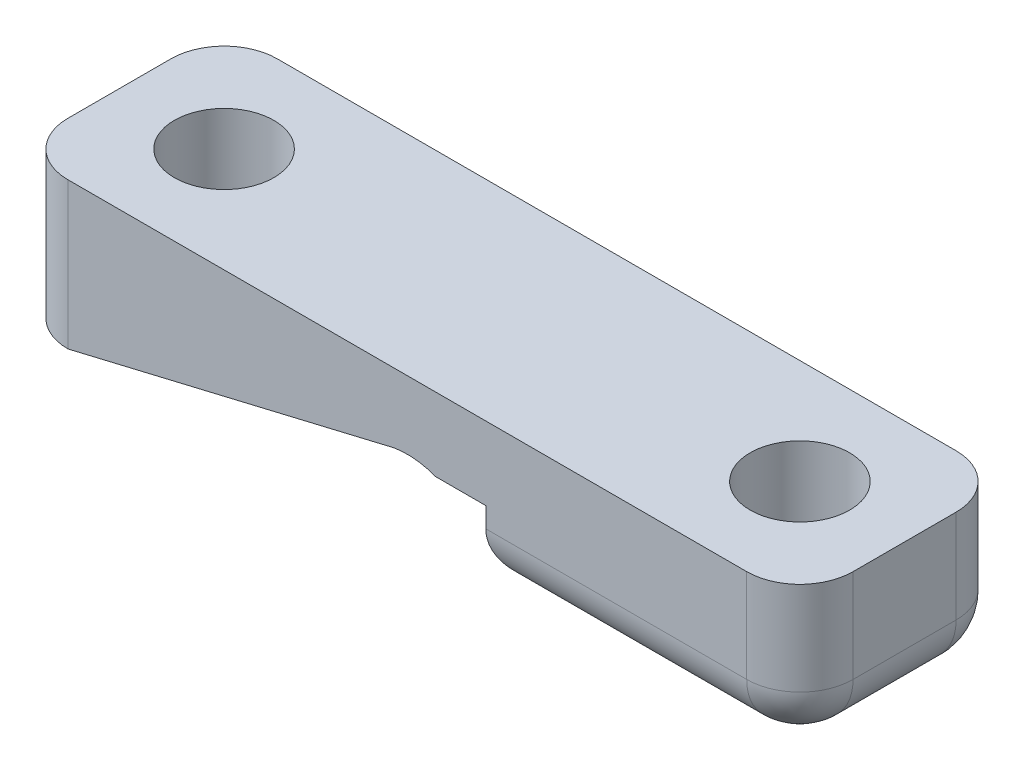
from build123d import *

# Parameters (mm, degrees)
SKETCH1_W               = 37.5
SKETCH1_H               = 7
BOSS_EXTRUDE1_DEPTH     = 10
CUT_EXTRUDE1_DEPTH      = 40.436658073
CUT_EXTRUDE1_DEPTH_BACK = 40.436658073
SKETCH2_R               = 3.75
FILLET1_R               = 2.54
F_4_0MM_DOWEL_HOLE1_D   = 4.75
CUT_EXTRUDE2_DEPTH      = 40.436658073
CUT_EXTRUDE2_DEPTH_BACK = 40.436658073
CUT_EXTRUDE3_DEPTH      = 3.5
FILLET2_R               = 2.54


with BuildPart() as part:
    # Sketch1 → Boss-Extrude1 (new body)
    with BuildSketch(Plane.XY):
        with Locations((18.75, 3.5)):
            Rectangle(SKETCH1_W, SKETCH1_H)
    extrude(amount=BOSS_EXTRUDE1_DEPTH)

    # Sketch2 → Cut-Extrude1 (cut, two sides: drawn at the far end of the back side and taken through both)
    with BuildSketch(Plane.XY.offset(10).offset(-CUT_EXTRUDE1_DEPTH_BACK)):
        with Locations((18.75, 0)):
            Circle(SKETCH2_R)
    extrude(amount=CUT_EXTRUDE1_DEPTH + CUT_EXTRUDE1_DEPTH_BACK, mode=Mode.SUBTRACT)

    # Fillet1
    fillet1_edges = [part.edges().sort_by_distance(p)[0] for p in [
        (37.5, 3.5, 10),
        (0, 3.5, 10),
        (37.5, 3.5, 0),
        (0, 3.5, 0),
    ]]
    fillet(fillet1_edges, radius=FILLET1_R)

    # Ø4.0mm Dowel Hole1 (through all)
    with Locations(Plane(origin=(0, 7, 0), x_dir=(1, 0, 0), z_dir=(0, 1, 0))):
        with Locations((5, -5), (32.5, -5)):
            Hole(F_4_0MM_DOWEL_HOLE1_D / 2)

    # Sketch6 → Cut-Extrude2 (cut, two sides: drawn at the far end of the back side and taken through both)
    with BuildSketch(Plane(origin=(0, 0, 0), x_dir=(-1, 0, 0), z_dir=(0, 0, -1)).offset(-CUT_EXTRUDE2_DEPTH_BACK)):
        Polygon((-2.54, 0), (-18.100943668, 3.693403021), (-18.100943668, 0), align=None)
    extrude(amount=CUT_EXTRUDE2_DEPTH + CUT_EXTRUDE2_DEPTH_BACK, mode=Mode.SUBTRACT)

    # Sketch7 → Cut-Extrude3 (cut)
    with BuildSketch(Plane.XZ):
        with BuildLine():
            Line((22.5, 6.78008281), (22.5, 0))
            Line((22.5, 0), (30.734125825, 0))
            ThreePointArc((30.734125825, 0), (25.400966559, 1.913143457), (22.5, 6.78008281))
        make_face()
        with BuildLine():
            Line((22.5, 10), (20.085032716, 10))
            Line((20.085032716, 10), (20.085032716, 0))
            Line((20.085032716, 0), (22.5, 0))
            Line((22.5, 0), (22.5, 6.78008281))
            ThreePointArc((22.5, 6.78008281), (22.34408442, 8.390041405), (22.5, 10))
        make_face()
    extrude(amount=-CUT_EXTRUDE3_DEPTH, mode=Mode.SUBTRACT)

    # Fillet2
    # the kernel refuses this fillet: 2.54 mm, written as the material it takes off along each edge
    with BuildSketch(Plane(origin=(16.15, 0, 10), x_dir=(0, 1, 0), z_dir=(1, 0, 0))) as fillet2_piece_1:
        with BuildLine():
            CenterArc((FILLET2_R, -FILLET2_R), FILLET2_R, 90, 90)
            Line((0, -FILLET2_R), (0, 0))
            Line((0, 0), (FILLET2_R, 0))
        make_face()
    extrude(amount=18.81, mode=Mode.SUBTRACT)
    with BuildSketch(Plane(origin=(34.96, 0, 7.46), x_dir=(0, 0, 1), z_dir=(-1, 0, 0))) as fillet2_piece_2:
        with BuildLine():
            CenterArc((2.54 - FILLET2_R, FILLET2_R), FILLET2_R, 270, 90)
            Line((2.54 - FILLET2_R, 0), (2.54, 0))
            Line((2.54, 0), (2.54, FILLET2_R))
        make_face()
    revolve(axis=Axis((34.96, 0, 7.46), (0, 1, 0)), revolution_arc=90, mode=Mode.SUBTRACT)
    with BuildSketch(Plane(origin=(37.5, 0, 2.54), x_dir=(-1, 0, 0), z_dir=(0, 0, 1))) as fillet2_piece_3:
        with BuildLine():
            CenterArc((FILLET2_R, -FILLET2_R), FILLET2_R, 90, 90)
            Line((0, -FILLET2_R), (0, 0))
            Line((0, 0), (FILLET2_R, 0))
        make_face()
    extrude(amount=4.92, mode=Mode.SUBTRACT)
    with BuildSketch(Plane(origin=(34.96, 0, 2.54), x_dir=(0, 0, -1), z_dir=(-1, 0, 0))) as fillet2_piece_4:
        with BuildLine():
            CenterArc((2.54 - FILLET2_R, -FILLET2_R), FILLET2_R, 0, 90)
            Line((2.54, -FILLET2_R), (2.54, 0))
            Line((2.54, 0), (2.54 - FILLET2_R, 0))
        make_face()
    revolve(axis=Axis((34.96, 0, 2.54), (0, -1, 0)), revolution_arc=90, mode=Mode.SUBTRACT)
    with BuildSketch(Plane(origin=(30.734125825, 0, 0), x_dir=(0, 1, 0), z_dir=(1, 0, 0))) as fillet2_piece_5:
        with BuildLine():
            CenterArc((FILLET2_R, FILLET2_R), FILLET2_R, 180, 90)
            Line((0, FILLET2_R), (0, 0))
            Line((0, 0), (FILLET2_R, 0))
        make_face()
    extrude(amount=4.225874175, mode=Mode.SUBTRACT)
    with BuildSketch(Plane(origin=(30.734125825, 0, 8.390041405), x_dir=(-0.8451253375205291, 0, 0.5345682032077963), z_dir=(0.5345682032077963, 0, 0.8451253375205291))) as fillet2_piece_6:
        with BuildLine():
            CenterArc((8.390041405 - FILLET2_R, -FILLET2_R), FILLET2_R, 0, 90)
            Line((8.390041405, -FILLET2_R), (8.390041405, 0))
            Line((8.390041405, 0), (8.390041405 - FILLET2_R, 0))
        make_face()
    revolve(axis=Axis((30.734125825, 0, 8.390041405), (0, -1, 0)), revolution_arc=122.314632757, mode=Mode.SUBTRACT)


solid = part.part
